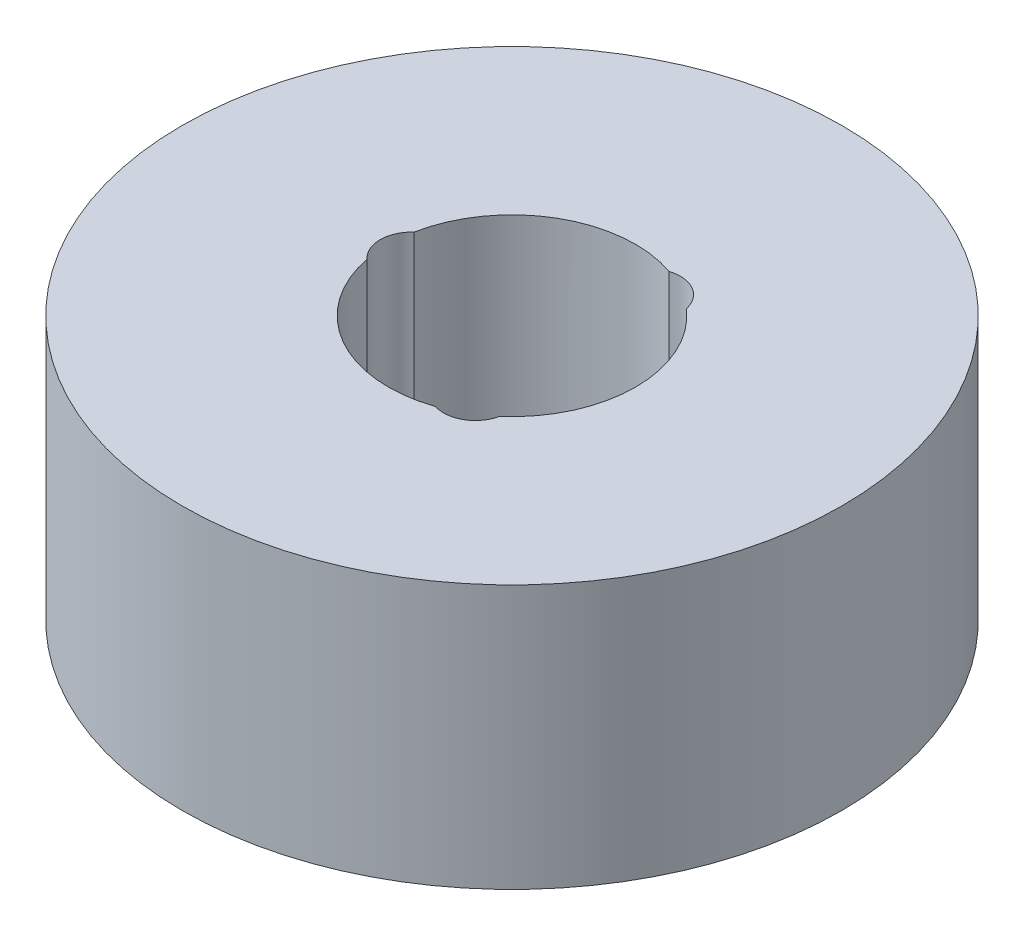
from build123d import *

# Parameters (mm, degrees)
SKETCH1_R           = 20
BOSS_EXTRUDE1_DEPTH = 16
SKETCH2_R           = 7.5
CUT_EXTRUDE1_DEPTH  = 33.496153619
SKETCH3_R           = 1.928231533
CUT_EXTRUDE2_DEPTH  = 9.814381685
CIRPATTERN1_COUNT   = 3


with BuildPart() as part:
    # Sketch1 → Boss-Extrude1 (new body)
    with BuildSketch(Plane(origin=(0, 0, 0), x_dir=(1, 0, 0), z_dir=(0, 1, 0))):
        Circle(SKETCH1_R)
    extrude(amount=BOSS_EXTRUDE1_DEPTH)

    # Sketch2 → Cut-Extrude1 (cut, through all)
    with BuildSketch(Plane(origin=(0, 0, 0), x_dir=(1, 0, 0), z_dir=(0, 1, 0))):
        Circle(SKETCH2_R)
    extrude(amount=CUT_EXTRUDE1_DEPTH, mode=Mode.SUBTRACT)

    # Sketch3 → Cut-Extrude2 (cut)
    with BuildSketch(Plane(origin=(0, 16, 0), x_dir=(1, 0, 0), z_dir=(0, 1, 0))):
        with Locations((-6.067340054, 0)):
            Circle(SKETCH3_R)
    cut_extrude2 = extrude(amount=-CUT_EXTRUDE2_DEPTH, mode=Mode.SUBTRACT)

    # CirPattern1: Cut-Extrude2 ×3 about axis
    cirpattern1_axis = Axis((0, 0, 0), (0, 1, 0))
    for i in range(1, CIRPATTERN1_COUNT):
        add(cut_extrude2.rotate(cirpattern1_axis, i * 360 / CIRPATTERN1_COUNT), mode=Mode.SUBTRACT)


solid = part.part
